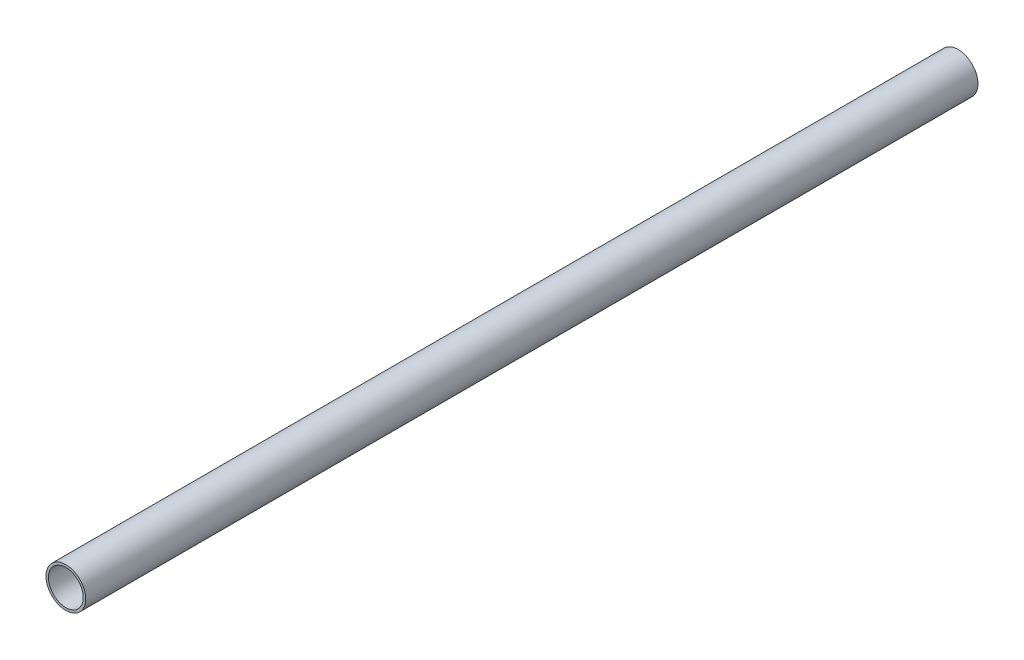
from build123d import *

# Parameters (mm, degrees)
SKETCH2_R           = 12.7
SKETCH2_R_2         = 11.1125
BOSS_EXTRUDE1_DEPTH = 285.09415041


with BuildPart() as part:
    # Sketch2 → Boss-Extrude1 (new, symmetric)
    with BuildSketch(Plane.XY):
        Circle(SKETCH2_R)
        Circle(SKETCH2_R_2, mode=Mode.SUBTRACT)
    extrude(amount=BOSS_EXTRUDE1_DEPTH, both=True)


solid = part.part
